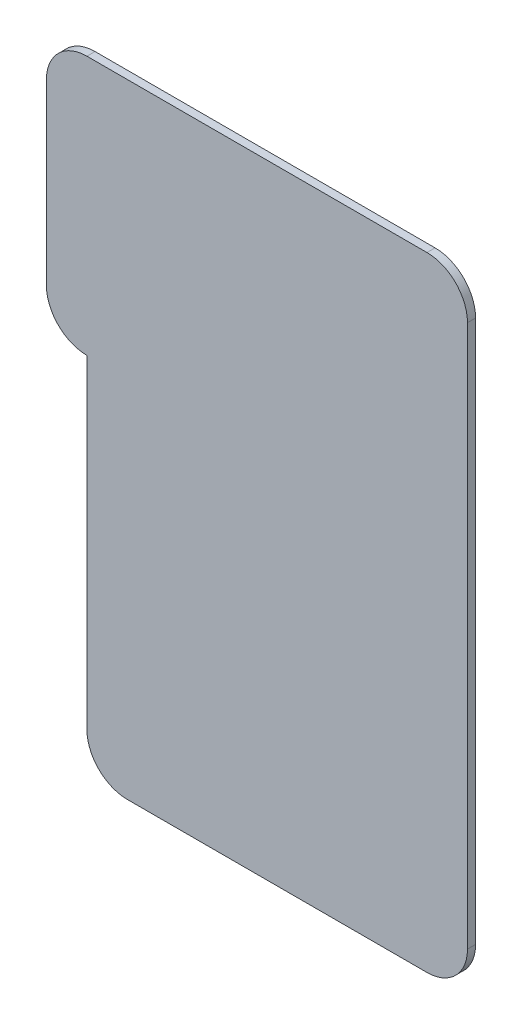
from build123d import *

# Parameters (mm, degrees)
BASE_FLANGE1_DEPTH = 2
FILLET1_R          = 10


# Sheet-metal steps are written as plain solids
with BuildPart() as part:
    # Sketch1 → Base-Flange1 (new body)
    with BuildSketch(Plane.XY):
        Polygon((-65, 15), (-75, 15), (-75, 79), (29, 79), (29, -75), (-65, -75), align=None)
    extrude(amount=-BASE_FLANGE1_DEPTH)

    # Fillet1
    fillet1_edges = [part.edges().sort_by_distance(p)[0] for p in [
        (-75, 79, -1),
        (-75, 15, -1),
        (-65, -75, -1),
        (29, -75, -1),
        (29, 79, -1),
    ]]
    fillet(fillet1_edges, radius=FILLET1_R - 0.0001)  # a hair under: the kernel refuses the full size


solid = part.part
